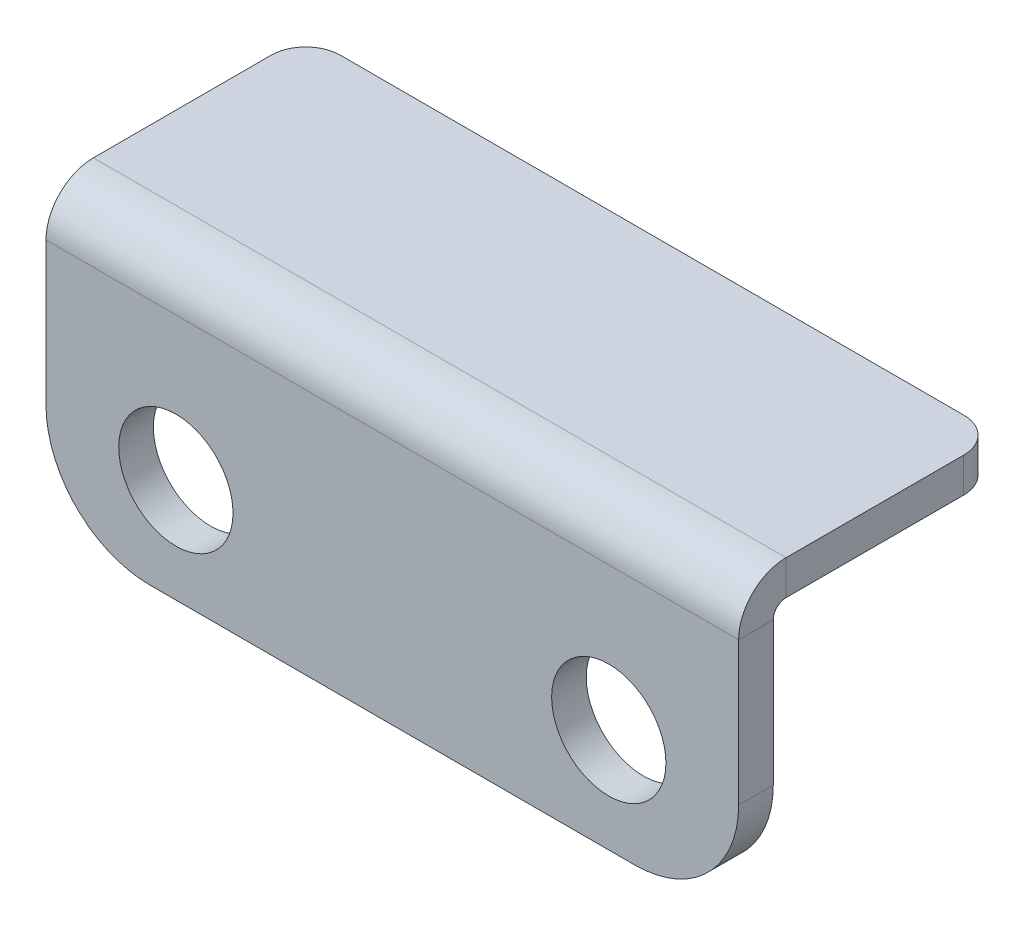
from build123d import *

# Parameters (mm, degrees)
SKETCH_2_W                       = 40
SKETCH_2_H                       = 17
SM_BASE_FLANGE_1_DEPTH           = 2
SM_EDGE_FLANGE_1_STRIP_W         = 9.4732
SM_EDGE_FLANGE_1_STRIP_H         = 2
SM_EDGE_FLANGE_1_STRIP_CUT_DEPTH = 40
SM_EDGE_FLANGE_1_DEPTH           = 40
SKETCH_10_R                      = 3.3
CUT_EXTRUDE_1_DEPTH              = 10
FILLET_1_R                       = 6
FILLET_2_R                       = 2


# Sheet-metal steps are written as plain solids
with BuildPart() as part:
    # Sketch 2 → 基体-法兰1 (new body)
    with BuildSketch(Plane.XY):
        Rectangle(SKETCH_2_W, SKETCH_2_H)
    extrude(amount=-SM_BASE_FLANGE_1_DEPTH)

    # 边线-法兰1 strip (across the edge) → 边线-法兰1 strip cut (cut)
    with BuildSketch(Plane(origin=(-20, 8.5, -2), x_dir=(0, -1, 0), z_dir=(1, 0, 0))):
        with Locations((-2, -1)):
            Rectangle(SM_EDGE_FLANGE_1_STRIP_W, SM_EDGE_FLANGE_1_STRIP_H)
    extrude(amount=SM_EDGE_FLANGE_1_STRIP_CUT_DEPTH, mode=Mode.SUBTRACT)

    # 边线-法兰1 section (across the edge) → 边线-法兰1 (add)
    with BuildSketch(Plane(origin=(-20, 8.5, -2), x_dir=(0, -1, 0), z_dir=(1, 0, 0))):
        with BuildLine():
            Line((0, 0.7366), (0, 13))
            Line((0, 13), (2, 13))
            Line((2, 13), (2, 0.7366))
            ThreePointArc((2, 0.7366), (2.215745145, 0.215745145), (2.7366, 0))
            Line((2.7366, 0), (2.7366, -2))
            ThreePointArc((2.7366, -2), (0.801531583, -1.198468417), (0, 0.7366))
        make_face()
    extrude(amount=SM_EDGE_FLANGE_1_DEPTH)

    # 草图10 → 切除-拉伸1 (cut)
    with BuildSketch(Plane(origin=(0, 0, -2), x_dir=(-1, 0, 0), z_dir=(0, 0, -1))):
        with Locations((-12.5, -2.5)):
            Circle(SKETCH_10_R)
        with Locations((12.5, -2.5)):
            Circle(SKETCH_10_R)
    extrude(amount=-CUT_EXTRUDE_1_DEPTH, mode=Mode.SUBTRACT)

    # 圆角1
    fillet_1_edges = [part.edges().sort_by_distance(p)[0] for p in [
        (20, -8.5, -1),
        (-20, -8.5, -1),
    ]]
    fillet(fillet_1_edges, radius=FILLET_1_R)

    # 圆角2
    fillet_2_edges = [part.edges().sort_by_distance(p)[0] for p in [
        (-20, 7.5, -15),
        (20, 7.5, -15),
    ]]
    fillet(fillet_2_edges, radius=FILLET_2_R)


solid = part.part
